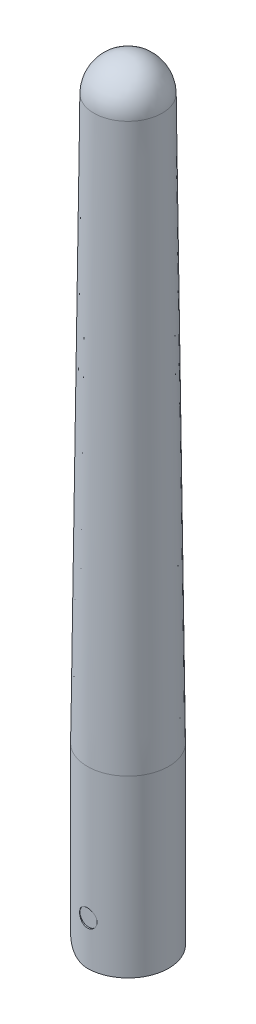
from build123d import *

# Parameters (mm, degrees)
SKETCH2_R           = 1
CUT_EXTRUDE1_DEPTH  = 5
CUT_EXTRUDE2_DEPTH  = 2.5
CUT_EXTRUDE3_DEPTH  = 5
SKETCH5_R           = 1
BOSS_EXTRUDE1_DEPTH = 4.5


with BuildPart() as part:
    # Sketch1 → Revolve1 (revolve)
    with BuildSketch(Plane.XY):
        with BuildLine():
            Line((0, 0), (0, 88.2))
            ThreePointArc((0, 88.2), (-2.741592985, 87.073746186), (-3.899734916, 84.345470721))
            Line((-3.899734916, 84.345470721), (-4.65, 20))
            Line((-4.65, 20), (-4.65, 0))
            Line((-4.65, 0), (0, 0))
        make_face()
    revolve(axis=Axis((0, 0, 0), (0, 1, 0)))

    # Sketch2 → Cut-Extrude1 (cut, symmetric)
    with BuildSketch(Plane.XY):
        with Locations((0, 5)):
            Circle(SKETCH2_R)
    extrude(amount=CUT_EXTRUDE1_DEPTH, both=True, mode=Mode.SUBTRACT)

    # Sketch3 → Cut-Extrude2 (cut, symmetric)
    with BuildSketch(Plane.XY):
        with BuildLine():
            Line((3, 0), (3, 5))
            ThreePointArc((3, 5), (2.121320344, 7.121320344), (0, 8))
            Line((0, 8), (-4.65, 8))
            Line((-4.65, 8), (-4.65, 0))
            Line((-4.65, 0), (3, 0))
        make_face()
    extrude(amount=CUT_EXTRUDE2_DEPTH, both=True, mode=Mode.SUBTRACT)

    # Sketch4 → Cut-Extrude3 (cut, symmetric)
    with BuildSketch(Plane.XY):
        with BuildLine():
            Line((-5, 5), (-8, 5))
            Line((-8, 5), (-8, -3))
            Line((-8, -3), (0, -3))
            Line((0, -3), (0, 0))
            ThreePointArc((0, 0), (-3.535533906, 1.464466094), (-5, 5))
        make_face()
    extrude(amount=CUT_EXTRUDE3_DEPTH, both=True, mode=Mode.SUBTRACT)

    # Sketch5 → Boss-Extrude1 (add, symmetric)
    with BuildSketch(Plane.XY):
        with Locations((0, 5)):
            Circle(SKETCH5_R)
    extrude(amount=BOSS_EXTRUDE1_DEPTH, both=True)


solid = part.part
